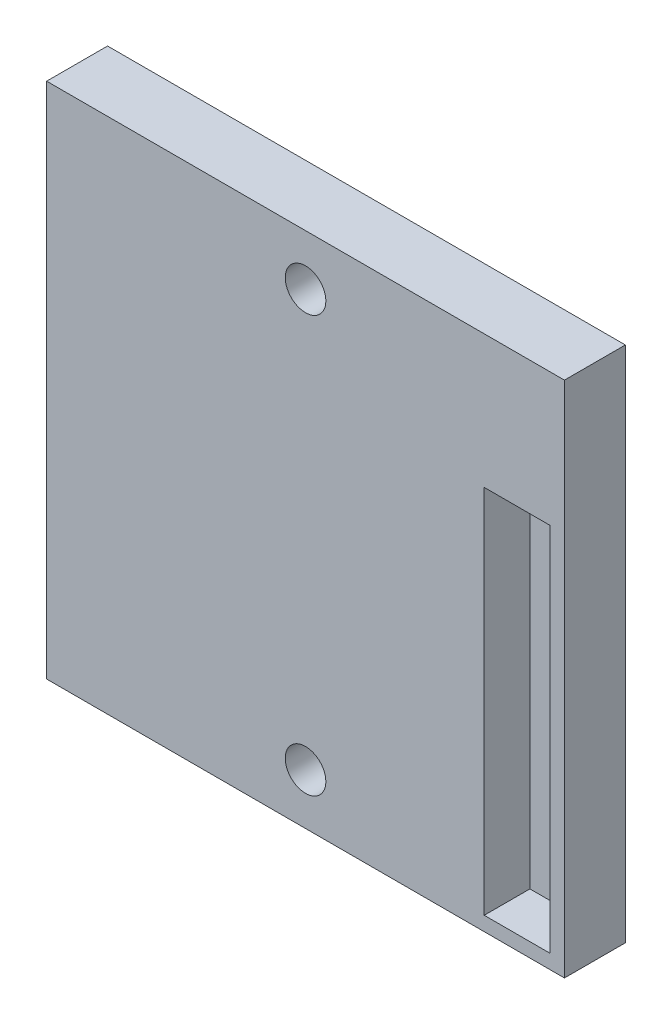
from build123d import *

# Parameters (mm, degrees)
ESBO_O1_W                = 51
ESBO_O1_H                = 51
RESSALTO_EXTRUS_O1_DEPTH = 6
ESBO_O2_W                = 6.5
ESBO_O2_H                = 36.5
CORTE_EXTRUS_O1_DEPTH    = 4.5
ESBO_O3_R                = 2
CORTE_EXTRUS_O2_DEPTH    = 37.558172821


with BuildPart() as part:
    # Esboço1 → Ressalto-extrusão1 (new body)
    with BuildSketch(Plane.XY):
        Rectangle(ESBO_O1_W, ESBO_O1_H)
    extrude(amount=RESSALTO_EXTRUS_O1_DEPTH)

    # Esboço2 → Corte-extrusão1 (cut)
    with BuildSketch(Plane(origin=(0, 0, 0), x_dir=(-1, 0, 0), z_dir=(0, 0, -1))):
        with Locations((-20.85, -5.85)):
            Rectangle(ESBO_O2_W, ESBO_O2_H)
    extrude(amount=-CORTE_EXTRUS_O1_DEPTH, mode=Mode.SUBTRACT)

    # Esboço3 → Corte-extrusão2 (cut, through all)
    with BuildSketch(Plane.XY.offset(6)):
        with Locations((0, -20.5)):
            Circle(ESBO_O3_R)
        with Locations((0, 20.5)):
            Circle(ESBO_O3_R)
    extrude(amount=-CORTE_EXTRUS_O2_DEPTH, mode=Mode.SUBTRACT)


with BuildPart() as body_2:
    # Espelhar2: mirrored copy
    add(part.part.mirror(Plane.XY.offset(-10)))


solid = body_2.part
